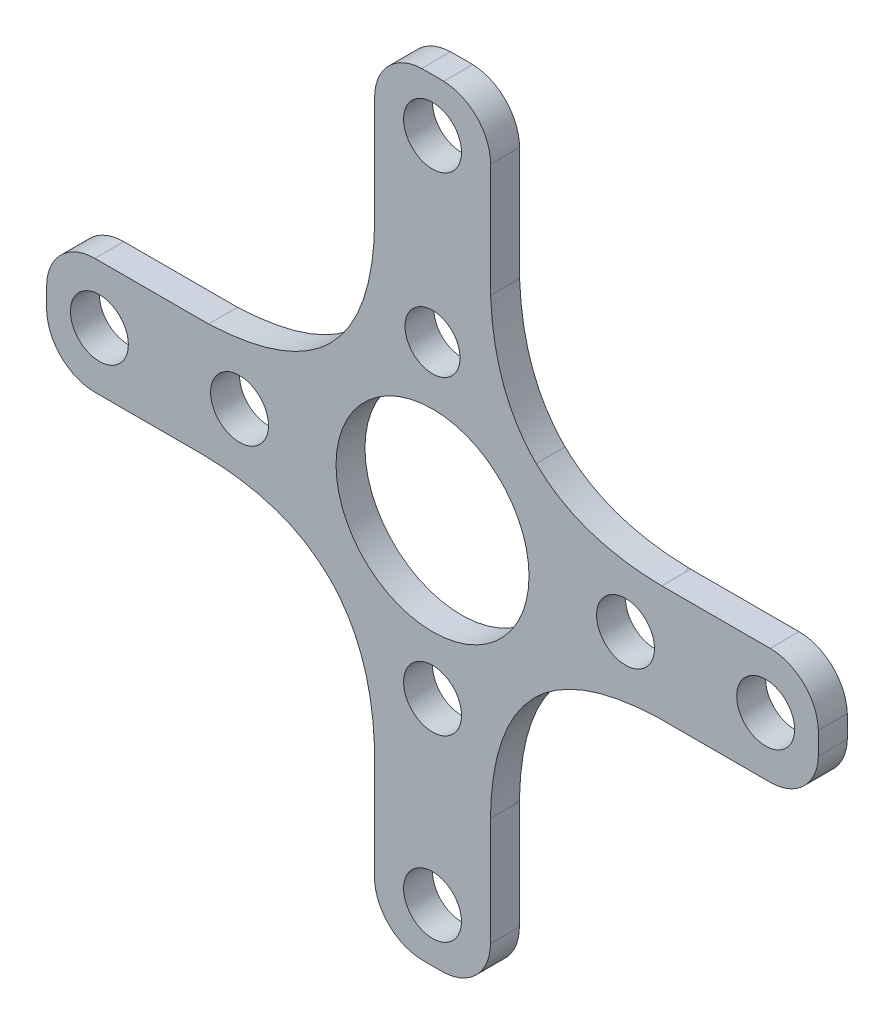
from build123d import *

# Parameters (mm, degrees)
SKETCH1_R                 = 14
BOSS_EXTRUDE1_DEPTH       = 18.5
CUT_EXTRUDE1_START        = -13.5
SKETCH2_R                 = 14
SKETCH2_R_2               = 5
CUT_EXTRUDE1_DEPTH        = 13.5
SKETCH3_R                 = 4
CUT_EXTRUDE2_DEPTH        = 22.5
CUT_EXTRUDE3_DEPTH        = 3.75
SKETCH8_R                 = 12.271364757
SKETCH8_R_2               = 6.141449245
CUT_EXTRUDE4_DEPTH        = 2.75
CIRPATTERN1_COUNT         = 4
SKETCH11_R                = 1.5
CUT_EXTRUDE5_DEPTH        = 3
SKETCH12_R                = 21.13637798
CUT_EXTRUDE6_DEPTH        = 17
BOSS_EXTRUDE2_START       = -1.5
BOSS_EXTRUDE2_OUTLINE_R   = 1.5
BOSS_EXTRUDE2_OUTLINE_R_2 = 1.517060808
BOSS_EXTRUDE2_OUTLINE_R_3 = 4
BOSS_EXTRUDE2_OUTLINE_R_4 = 1.426709917
BOSS_EXTRUDE2_DEPTH       = 1.5
FILLET1_R                 = 2.5
SKETCH14_R                = 1.5
SKETCH14_R_2              = 5
CUT_EXTRUDE7_DEPTH        = 14.5


# Read off the part's stored shape, not the designer's step: Boss-Extrude2
with BuildPart() as part:
    # Sketch1 → Boss-Extrude1 (new body)
    with BuildSketch(Plane.XY):
        Circle(SKETCH1_R)
    extrude(amount=BOSS_EXTRUDE1_DEPTH)

    # Sketch2 → Cut-Extrude1 (cut)
    with BuildSketch(Plane.XY.offset(18.5).offset(CUT_EXTRUDE1_START)):
        Circle(SKETCH2_R)
        Circle(SKETCH2_R_2, mode=Mode.SUBTRACT)
    extrude(amount=CUT_EXTRUDE1_DEPTH, mode=Mode.SUBTRACT)

    # Sketch3 → Cut-Extrude2 (cut)
    with BuildSketch(Plane.XY.offset(18.5)):
        Circle(SKETCH3_R)
    extrude(amount=-CUT_EXTRUDE2_DEPTH, mode=Mode.SUBTRACT)

    # Sketch6 → Cut-Revolve1 (revolve, cut)
    with BuildSketch(Plane(origin=(0, 0, 0), x_dir=(0, 0, -1), z_dir=(1, 0, 0)), mode=Mode.PRIVATE) as cut_revolve1_sk:
        Polygon((-4.949121361, 14), (3.777639186, 16.199586118), (5.061522468, 10.233304984), align=None)
    revolve(cut_revolve1_sk.sketch.rotate(Axis((0, 0, 19.921792725), (0, 0, -1)), 90), axis=Axis((0, 0, 19.921792725), (0, 0, -1)), mode=Mode.SUBTRACT)

    # Sketch7 → Cut-Extrude3 (cut)
    with BuildSketch(Plane(origin=(0, 0, 0), x_dir=(-1, 0, 0), z_dir=(0, 0, -1))):
        with BuildLine():
            Line((3, 15.639460569), (3, 11.87697352))
            add(Edge.make_bspline(
                [(3, 11.87697352), (3.121054504, 3.206614769), (11.87697352, 3)],
                knots=[0, 0, 0, 1, 1, 1], degree=2))
            Line((11.87697352, 3), (17.86108213, 3))
            Line((17.86108213, 3), (14.869027825, 14.316513241))
            Line((14.869027825, 14.316513241), (3, 15.639460569))
        make_face()
    cut_extrude3 = extrude(amount=-CUT_EXTRUDE3_DEPTH, mode=Mode.SUBTRACT)

    # Sketch8 → Cut-Extrude4 (cut)
    with BuildSketch(Plane.XY.offset(5)):
        Circle(SKETCH8_R)
        Circle(SKETCH8_R_2, mode=Mode.SUBTRACT)
    extrude(amount=-CUT_EXTRUDE4_DEPTH, mode=Mode.SUBTRACT)

    # Sketch9 → Cut-Revolve2 (revolve, cut)
    with BuildSketch(Plane(origin=(0, 0, 0), x_dir=(1, 0, 0), z_dir=(0, 1, 0)), mode=Mode.PRIVATE) as cut_revolve2_sk:
        Polygon((-12.001476603, -2.22152714), (-13.001507243, -5.36905248), (-11.155114973, -5.36905248), align=None)
    revolve(cut_revolve2_sk.sketch.rotate(Axis((0, 0, -1.742471472), (0, 0, 1)), 180), axis=Axis((0, 0, -1.742471472), (0, 0, 1)), mode=Mode.SUBTRACT)

    # Sketch10 → Cut-Revolve3 (revolve, cut)
    with BuildSketch(Plane(origin=(0, 0, 0), x_dir=(1, 0, 0), z_dir=(0, 1, 0)), mode=Mode.PRIVATE) as cut_revolve3_sk:
        Polygon((-5, -5), (-6.141449245, -2.28305418), (-6.572257958, -5.413209842), align=None)
    revolve(cut_revolve3_sk.sketch.rotate(Axis((0, 0, 0), (0, 0, -1)), 180), axis=Axis((0, 0, 0), (0, 0, -1)), mode=Mode.SUBTRACT)

    # CirPattern1: Cut-Extrude3 ×4 about axis
    cirpattern1_axis = Axis((0, 0, 3.75), (0, 0, 1))
    for i in range(1, CIRPATTERN1_COUNT):
        add(cut_extrude3.rotate(cirpattern1_axis, i * 360 / CIRPATTERN1_COUNT), mode=Mode.SUBTRACT)

    # Sketch11 → Cut-Extrude5 (cut)
    with BuildSketch(Plane(origin=(0, 0, 0), x_dir=(-1, 0, 0), z_dir=(0, 0, -1))):
        with Locations((0, 8)):
            Circle(SKETCH11_R)
        with Locations((0, -8)):
            Circle(SKETCH11_R)
        with Locations((-10, 0)):
            Circle(SKETCH11_R)
        with Locations((10, 0)):
            Circle(SKETCH11_R)
    extrude(amount=-CUT_EXTRUDE5_DEPTH, mode=Mode.SUBTRACT)

    # Sketch12 → Cut-Extrude6 (cut)
    with BuildSketch(Plane.XY.offset(18.5)):
        Circle(SKETCH12_R)
    extrude(amount=-CUT_EXTRUDE6_DEPTH, mode=Mode.SUBTRACT)

    # Boss-Extrude2 outline → Boss-Extrude2 (add)
    # profile 1 of 7: a face of its own
    with BuildSketch(Plane(origin=(0, 0, 0), x_dir=(-1, 0, 0), z_dir=(0, 0, -1)).offset(BOSS_EXTRUDE2_START)):
        with BuildLine():
            add(Edge.make_bspline(
                [(3.00190242, 11.760729011), (3.000755095, 11.818659857), (3, 11.87697352)],
                knots=[0.993159083, 0.993159083, 0.993159083, 1, 1, 1], degree=2))
            Line((3, 11.87697352), (3, 19.773719933))
            ThreePointArc((3, 19.773719933), (-0.004378174, 19.999999521), (-3.00865699, 19.772404586))
            Line((-3.00865699, 19.772404586), (-3.008656992, 11.602060374))
            add(Edge.make_bspline(
                [(-5.368896851, 5.233886038), (-3.175302873, 7.384008673), (-3.008656992, 11.602060374)],
                knots=[0.4948048, 0.4948048, 0.4948048, 0.984177857, 0.984177857, 0.984177857], degree=2))
            add(Edge.make_bspline(
                [(-5.368896851, 5.233886038), (-7.55686142, 3.085160323), (-11.760729011, 3.00190242)],
                knots=[0.496734279, 0.496734279, 0.496734279, 0.993159083, 0.993159083, 0.993159083], degree=2))
            add(Edge.make_bspline(
                [(-11.760729011, 3.00190242), (-11.818659857, 3.000755095), (-11.87697352, 3)],
                knots=[0.993159083, 0.993159083, 0.993159083, 1, 1, 1], degree=2))
            Line((-11.87697352, 3), (-19.773719933, 3))
            ThreePointArc((-19.773719933, 3), (-19.999999521, -0.004378174), (-19.772404586, -3.00865699))
            Line((-19.772404586, -3.00865699), (-11.602060374, -3.008656992))
            add(Edge.make_bspline(
                [(-5.233886038, -5.368896851), (-7.384008673, -3.175302873), (-11.602060374, -3.008656992)],
                knots=[0.4948048, 0.4948048, 0.4948048, 0.984177857, 0.984177857, 0.984177857], degree=2))
            add(Edge.make_bspline(
                [(-5.233886038, -5.368896851), (-3.085160323, -7.55686142), (-3.00190242, -11.760729011)],
                knots=[0.496734279, 0.496734279, 0.496734279, 0.993159083, 0.993159083, 0.993159083], degree=2))
            add(Edge.make_bspline(
                [(-3.00190242, -11.760729011), (-3.000755095, -11.818659857), (-3, -11.87697352)],
                knots=[0.993159083, 0.993159083, 0.993159083, 1, 1, 1], degree=2))
            Line((-3, -11.87697352), (-3, -19.773719933))
            ThreePointArc((-3, -19.773719933), (0.004378174, -19.999999521), (3.00865699, -19.772404586))
            Line((3.00865699, -19.772404586), (3.008656992, -11.602060374))
            add(Edge.make_bspline(
                [(5.368896851, -5.233886038), (3.175302873, -7.384008673), (3.008656992, -11.602060374)],
                knots=[0.4948048, 0.4948048, 0.4948048, 0.984177857, 0.984177857, 0.984177857], degree=2))
            add(Edge.make_bspline(
                [(5.368896851, -5.233886038), (7.55686142, -3.085160323), (11.760729011, -3.00190242)],
                knots=[0.496734279, 0.496734279, 0.496734279, 0.993159083, 0.993159083, 0.993159083], degree=2))
            add(Edge.make_bspline(
                [(11.760729011, -3.00190242), (11.818659857, -3.000755095), (11.87697352, -3)],
                knots=[0.993159083, 0.993159083, 0.993159083, 1, 1, 1], degree=2))
            Line((11.87697352, -3), (19.773719933, -3))
            ThreePointArc((19.773719933, -3), (19.999999521, 0.004378174), (19.772404586, 3.00865699))
            Line((19.772404586, 3.00865699), (11.602060374, 3.008656992))
            add(Edge.make_bspline(
                [(5.233886023, 5.368896867), (7.384008658, 3.175302874), (11.602060374, 3.008656992)],
                knots=[0.494804799, 0.494804799, 0.494804799, 0.984177857, 0.984177857, 0.984177857], degree=2))
            add(Edge.make_bspline(
                [(5.233886023, 5.368896867), (3.085160322, 7.556861435), (3.00190242, 11.760729011)],
                knots=[0.496734281, 0.496734281, 0.496734281, 0.993159083, 0.993159083, 0.993159083], degree=2))
        make_face()
        with Locations((0, -8)):
            Circle(BOSS_EXTRUDE2_OUTLINE_R, mode=Mode.SUBTRACT)
        with Locations((-10, 0)):
            Circle(BOSS_EXTRUDE2_OUTLINE_R_2, mode=Mode.SUBTRACT)
        Circle(BOSS_EXTRUDE2_OUTLINE_R_3, mode=Mode.SUBTRACT)
        with Locations((0, 8)):
            Circle(BOSS_EXTRUDE2_OUTLINE_R, mode=Mode.SUBTRACT)
        with Locations((10, 0)):
            Circle(BOSS_EXTRUDE2_OUTLINE_R, mode=Mode.SUBTRACT)
    # profile 2 of 7: a face of its own
    with BuildSketch(Plane(origin=(0, 0, 0), x_dir=(-1, 0, 0), z_dir=(0, 0, -1)).offset(BOSS_EXTRUDE2_START)):
        with BuildLine():
            add(Edge.make_bspline(
                [(11.60206042, 3.00865699), (7.383951275, 3.179568286), (5.233886023, 5.368896867)],
                knots=[0, 0, 0, 0.496734281, 0.496734281, 0.496734281], degree=2))
            add(Edge.make_bspline(
                [(5.233886023, 5.368896867), (7.384008658, 3.175302874), (11.60206042, 3.00865699)],
                knots=[0.494804799, 0.494804799, 0.494804799, 0.984177857, 0.984177857, 0.984177857], degree=2))
        make_face()
    # profile 3 of 7: a face of its own
    with BuildSketch(Plane(origin=(0, 0, 0), x_dir=(-1, 0, 0), z_dir=(0, 0, -1)).offset(BOSS_EXTRUDE2_START)):
        with BuildLine():
            add(Edge.make_bspline(
                [(-5.368896851, 5.233886038), (-3.175302873, 7.384008673), (-3.008656992, 11.602060374)],
                knots=[0.4948048, 0.4948048, 0.4948048, 0.984177857, 0.984177857, 0.984177857], degree=2))
            add(Edge.make_bspline(
                [(-3.008656992, 11.602060374), (-3.179568285, 7.383951289), (-5.368896851, 5.233886038)],
                knots=[0, 0, 0, 0.496734279, 0.496734279, 0.496734279], degree=2))
        make_face()
    # profile 4 of 7: a face of its own
    with BuildSketch(Plane(origin=(0, 0, 0), x_dir=(-1, 0, 0), z_dir=(0, 0, -1)).offset(BOSS_EXTRUDE2_START)):
        with BuildLine():
            add(Edge.make_bspline(
                [(3.00865699, -11.60206042), (3.179568285, -7.383951289), (5.368896851, -5.233886038)],
                knots=[0, 0, 0, 0.496734279, 0.496734279, 0.496734279], degree=2))
            add(Edge.make_bspline(
                [(5.368896851, -5.233886038), (3.175302873, -7.384008673), (3.00865699, -11.60206042)],
                knots=[0.4948048, 0.4948048, 0.4948048, 0.984177857, 0.984177857, 0.984177857], degree=2))
        make_face()
    # profile 5 of 7: a face of its own
    with BuildSketch(Plane(origin=(0, 0, 0), x_dir=(-1, 0, 0), z_dir=(0, 0, -1)).offset(BOSS_EXTRUDE2_START)):
        with BuildLine():
            add(Edge.make_bspline(
                [(-5.233886038, -5.368896851), (-7.384008673, -3.175302873), (-11.602060374, -3.008656992)],
                knots=[0.4948048, 0.4948048, 0.4948048, 0.984177857, 0.984177857, 0.984177857], degree=2))
            add(Edge.make_bspline(
                [(-11.602060374, -3.008656992), (-7.383951289, -3.179568285), (-5.233886038, -5.368896851)],
                knots=[0, 0, 0, 0.496734279, 0.496734279, 0.496734279], degree=2))
        make_face()
    # profile 6 of 7: a face of its own
    with BuildSketch(Plane(origin=(0, 0, 0), x_dir=(-1, 0, 0), z_dir=(0, 0, -1)).offset(BOSS_EXTRUDE2_START)):
        Circle(BOSS_EXTRUDE2_OUTLINE_R_3)
    # profile 7 of 7: a face of its own
    with BuildSketch(Plane(origin=(0, 0, 0), x_dir=(-1, 0, 0), z_dir=(0, 0, -1)).offset(BOSS_EXTRUDE2_START)):
        with Locations((0, 8)):
            Circle(BOSS_EXTRUDE2_OUTLINE_R)
        with Locations((0, 8)):
            Circle(BOSS_EXTRUDE2_OUTLINE_R_4, mode=Mode.SUBTRACT)
    extrude(amount=BOSS_EXTRUDE2_DEPTH)

    # Fillet1
    fillet1_edges = [part.edges().sort_by_distance(p)[0] for p in [
        (-19.772404586, 3.00865699, 0.75),
        (-19.773719933, -3, 0.75),
        (-3.00865699, -19.772404586, 0.75),
        (3, -19.773719933, 0.75),
        (19.772404586, -3.00865699, 0.75),
        (19.773719933, 3, 0.75),
        (-3, 19.773719933, 0.75),
        (3.00865699, 19.772404586, 0.75),
    ]]
    fillet(fillet1_edges, radius=FILLET1_R)

    # Sketch14 → Cut-Extrude7 (cut)
    with BuildSketch(Plane(origin=(0, 0, 0), x_dir=(-1, 0, 0), z_dir=(0, 0, -1))):
        with Locations((0, 17.261717903)):
            Circle(SKETCH14_R)
        with Locations((17.261717903, 0)):
            Circle(SKETCH14_R)
        with Locations((0, -17.261717903)):
            Circle(SKETCH14_R)
        with Locations((-17.261717903, 0)):
            Circle(SKETCH14_R)
        Circle(SKETCH14_R_2)
    extrude(amount=-CUT_EXTRUDE7_DEPTH, mode=Mode.SUBTRACT)


solid = part.part
